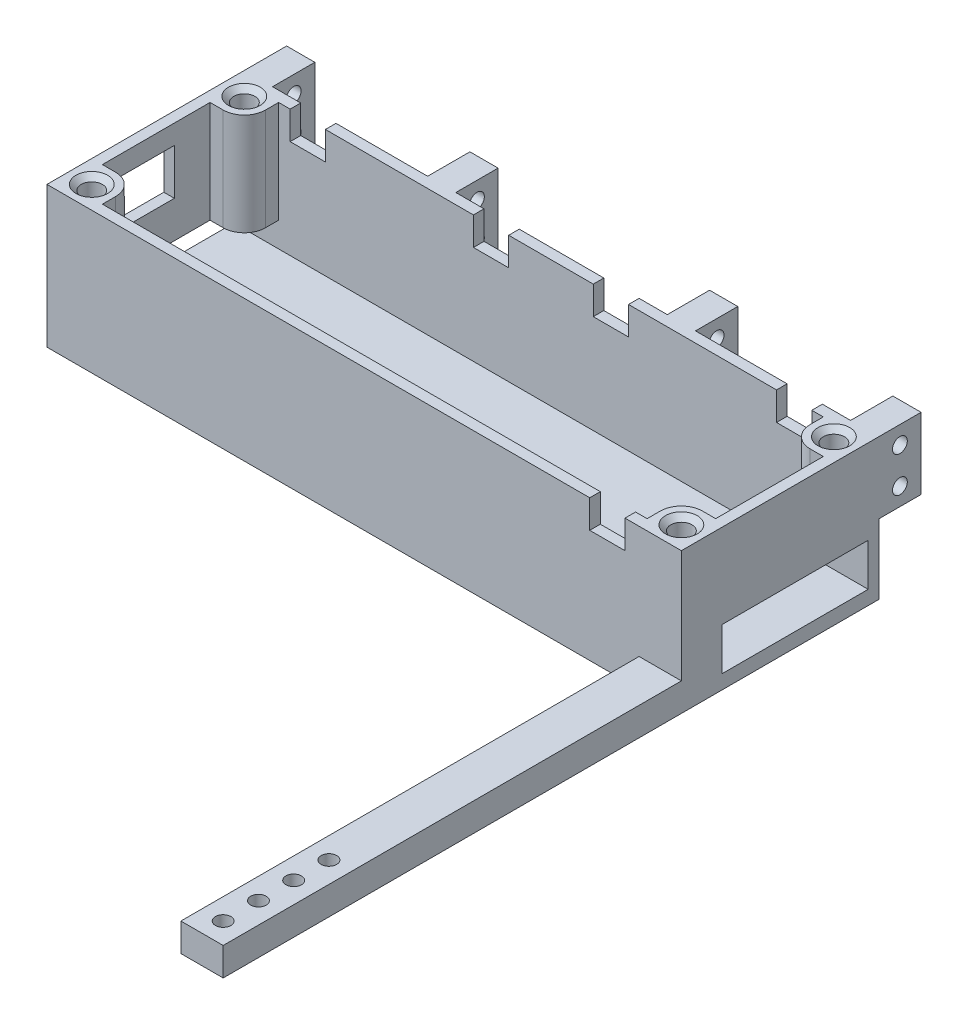
from build123d import *

# Parameters (mm, degrees)
SKETCH2_W           = 87
SKETCH2_H           = 25
BOSS_EXTRUDE1_DEPTH = 2
SKETCH2_3_W         = 90
SKETCH2_3_H         = 28
SKETCH2_3_W_2       = 87
SKETCH2_3_H_2       = 25
BOSS_EXTRUDE2_DEPTH = 20
SKETCH3_W           = 4
SKETCH3_H           = 10.1
BOSS_EXTRUDE3_DEPTH = 6
SKETCH5_R           = 1.05
CUT_EXTRUDE2_DEPTH  = 105
SKETCH3_5_W         = 5
SKETCH3_5_H         = 4
CUT_EXTRUDE3_DEPTH  = 16
SKETCH2_4_W         = 6
SKETCH2_4_H         = 55
BOSS_EXTRUDE4_DEPTH = 4
SKETCH8_W           = 4.863961031
SKETCH8_H           = 4.863961031
SKETCH8_W_2         = 4.86396103
BOSS_EXTRUDE5_DEPTH = 18
SKETCH9_R           = 1.5
CUT_EXTRUDE6_DEPTH  = 5
SKETCH6_W           = 11.14966652
SKETCH6_H           = 6.5
CUT_EXTRUDE4_DEPTH  = 16
FILLET1_R           = 3
SKETCH10_W          = 20.745878282
SKETCH10_H          = 3.532229036
CUT_EXTRUDE7_DEPTH  = 109.1
SKETCH11_W          = 5
SKETCH11_H          = 4
CUT_EXTRUDE8_DEPTH  = 4
SKETCH12_W          = 20.745878282
SKETCH12_H          = 2.501759487
CUT_EXTRUDE10_DEPTH = 8
SKETCH13_R          = 2.25
BOSS_EXTRUDE6_DEPTH = 3
CHAMFER1_SIZE       = 0.75
SKETCH17_W          = 6
SKETCH17_H          = 4
BOSS_EXTRUDE9_DEPTH = 10
SKETCH7_R           = 1.1
CUT_EXTRUDE5_DEPTH  = 10
CUT_EXTRUDE11_START = -1
SKETCH18_R          = 2.25
CUT_EXTRUDE11_DEPTH = 1


with BuildPart() as part:
    # Sketch2 → Boss-Extrude1 (new body)
    with BuildSketch(Plane(origin=(0, 0, 0), x_dir=(1, 0, 0), z_dir=(0, 1, 0))):
        with Locations((-2.329700272, 12.5)):
            Rectangle(SKETCH2_W, SKETCH2_H)
    extrude(amount=BOSS_EXTRUDE1_DEPTH)

    # Sketch2<3> → Boss-Extrude2 (add)
    with BuildSketch(Plane(origin=(0, 0, 0), x_dir=(1, 0, 0), z_dir=(0, 1, 0))):
        with Locations((-2.329700272, 12.5)):
            Rectangle(SKETCH2_3_W, SKETCH2_3_H)
        with Locations((-2.329700272, 12.5)):
            Rectangle(SKETCH2_3_W_2, SKETCH2_3_H_2, mode=Mode.SUBTRACT)
    extrude(amount=BOSS_EXTRUDE2_DEPTH)

    # Sketch3 → Boss-Extrude3 (add)
    with BuildSketch(Plane(origin=(0, 0, -26.5), x_dir=(-1, 0, 0), z_dir=(0, 0, -1))):
        with Locations((45.329700272, 14.95)):
            Rectangle(SKETCH3_W, SKETCH3_H)
        with Locations((-14.670299728, 14.95)):
            Rectangle(SKETCH3_W, SKETCH3_H)
        with Locations((-40.670299728, 14.95)):
            Rectangle(SKETCH3_W, SKETCH3_H)
        with Locations((19.329700272, 14.95)):
            Rectangle(SKETCH3_W, SKETCH3_H)
    extrude(amount=BOSS_EXTRUDE3_DEPTH)

    # Sketch5 → Cut-Extrude2 (cut)
    with BuildSketch(Plane.ZY.offset(47.329700272)):
        with Locations((-29.5, 12.425)):
            Circle(SKETCH5_R)
        with Locations((-29.5, 17.475)):
            Circle(SKETCH5_R)
    extrude(amount=-CUT_EXTRUDE2_DEPTH, mode=Mode.SUBTRACT)

    # Sketch3<5> → Cut-Extrude3 (cut)
    with BuildSketch(Plane(origin=(0, 0, -26.5), x_dir=(-1, 0, 0), z_dir=(0, 0, -1))):
        with Locations((36.829700272, 18)):
            Rectangle(SKETCH3_5_W, SKETCH3_5_H)
        with Locations((10.829700272, 18)):
            Rectangle(SKETCH3_5_W, SKETCH3_5_H)
        with Locations((-32.170299728, 18)):
            Rectangle(SKETCH3_5_W, SKETCH3_5_H)
        with Locations((-6.170299728, 18)):
            Rectangle(SKETCH3_5_W, SKETCH3_5_H)
    extrude(amount=-CUT_EXTRUDE3_DEPTH, mode=Mode.SUBTRACT)

    # Sketch2<4> → Boss-Extrude4 (add)
    with BuildSketch(Plane(origin=(0, 0, 0), x_dir=(1, 0, 0), z_dir=(0, 1, 0))):
        with Locations((39.670299728, -29)):
            Rectangle(SKETCH2_4_W, SKETCH2_4_H)
    extrude(amount=BOSS_EXTRUDE4_DEPTH)

    # Sketch8 → Boss-Extrude5 (add)
    with BuildSketch(Plane(origin=(0, 2, 0), x_dir=(1, 0, 0), z_dir=(0, 1, 0))):
        with Locations((38.738319213, 22.568019484)):
            Rectangle(SKETCH8_W, SKETCH8_H)
        with Locations((38.738319213, 2.431980516)):
            Rectangle(SKETCH8_W, SKETCH8_H)
        with Locations((-43.397719757, 22.568019484)):
            Rectangle(SKETCH8_W_2, SKETCH8_H)
        with Locations((-43.397719757, 2.431980516)):
            Rectangle(SKETCH8_W_2, SKETCH8_H)
    extrude(amount=BOSS_EXTRUDE5_DEPTH)

    # Sketch9 → Cut-Extrude6 (cut)
    with BuildSketch(Plane(origin=(0, 20, 0), x_dir=(1, 0, 0), z_dir=(0, 1, 0))):
        with Locations(Location((-44.147719757, 23.318019485, 0), (0, 0, 270))):
            Circle(SKETCH9_R)
        with Locations(Location((-44.147719757, 1.681980515, 0), (0, 0, 90))):
            Circle(SKETCH9_R)
        with Locations(Location((39.488319212, 1.681980515, 0), (0, 0, 270))):
            Circle(SKETCH9_R)
        with Locations(Location((39.488319212, 23.318019485, 0), (0, 0, 90))):
            Circle(SKETCH9_R)
    extrude(amount=-CUT_EXTRUDE6_DEPTH, mode=Mode.SUBTRACT)

    # Sketch6 → Cut-Extrude4 (cut)
    with BuildSketch(Plane.ZY.offset(47.329700272)):
        with Locations((-9.5, 14)):
            Rectangle(SKETCH6_W, SKETCH6_H)
    extrude(amount=-CUT_EXTRUDE4_DEPTH, mode=Mode.SUBTRACT)

    # Fillet1
    # the kernel refuses this fillet: 3 mm, written as the material it takes off along each edge
    with BuildSketch(Plane(origin=(36.306338697, 2, -4.863961031), x_dir=(0, 0, 1), z_dir=(0, 1, 0)), Plane(origin=(-40.965739242, 2, -20.136038969), x_dir=(0, 0, -1), z_dir=(0, 1, 0))) as fillet1_piece_1:
        with BuildLine():
            CenterArc((FILLET1_R, FILLET1_R), FILLET1_R, 180, 90)
            Line((0, FILLET1_R), (0, 0))
            Line((0, 0), (FILLET1_R, 0))
        make_face()
    extrude(amount=25.5, mode=Mode.SUBTRACT)
    with BuildSketch(Plane(origin=(36.306338697, 2, -20.136038969), x_dir=(0, 0, -1), z_dir=(0, 1, 0))) as fillet1_piece_2:
        with BuildLine():
            CenterArc((FILLET1_R, -FILLET1_R), FILLET1_R, 90, 90)
            Line((0, -FILLET1_R), (0, 0))
            Line((0, 0), (FILLET1_R, 0))
        make_face()
    extrude(amount=25.5, mode=Mode.SUBTRACT)
    with BuildSketch(Plane(origin=(-40.965739242, 2, -4.863961031), x_dir=(0, 0, 1), z_dir=(0, 1, 0))) as fillet1_piece_3:
        with BuildLine():
            CenterArc((FILLET1_R, -FILLET1_R), FILLET1_R, 90, 90)
            Line((0, -FILLET1_R), (0, 0))
            Line((0, 0), (FILLET1_R, 0))
        make_face()
    extrude(amount=16.25, mode=Mode.SUBTRACT)
    with BuildSketch(Plane(origin=(-40.965739242, 9.75, -4.863961031), x_dir=(-1, 0, 0), z_dir=(0, 1, 0))) as fillet1_piece_4:
        with BuildLine():
            CenterArc((FILLET1_R, FILLET1_R), FILLET1_R, 180, 90)
            Line((0, FILLET1_R), (0, 0))
            Line((0, 0), (FILLET1_R, 0))
        make_face()
    extrude(amount=17.75, mode=Mode.SUBTRACT)

    # Sketch10 → Cut-Extrude7 (cut)
    with BuildSketch(Plane.ZY.offset(47.329700272)):
        with Locations((-14.627060859, 3.766114518)):
            Rectangle(SKETCH10_W, SKETCH10_H)
    extrude(amount=-CUT_EXTRUDE7_DEPTH, mode=Mode.SUBTRACT)

    # Sketch11 → Cut-Extrude8 (cut)
    with BuildSketch(Plane.XY.offset(1.5)):
        with Locations((32.170299728, 18)):
            Rectangle(SKETCH11_W, SKETCH11_H)
    extrude(amount=-CUT_EXTRUDE8_DEPTH, mode=Mode.SUBTRACT)

    # Sketch12 → Cut-Extrude10 (cut)
    with BuildSketch(Plane(origin=(42.670299728, 0, 0), x_dir=(0, 0, -1), z_dir=(1, 0, 0))):
        with Locations((14.627060859, 6.78310878)):
            Rectangle(SKETCH12_W, SKETCH12_H)
    extrude(amount=-CUT_EXTRUDE10_DEPTH, mode=Mode.SUBTRACT)

    # Sketch13 → Boss-Extrude6 (add)
    # profile 1 of 2: a face of its own
    with BuildSketch(Plane(origin=(0, 2, 0), x_dir=(1, 0, 0), z_dir=(0, 1, 0))):
        with BuildLine():
            Line((-40.965739242, 1.863961031), (-40.965739242, 0))
            Line((-40.965739242, 0), (-34.465739242, 0))
            Line((-34.465739242, 0), (-34.465739242, 5.247890406))
            ThreePointArc((-34.465739242, 5.247890406), (-34.758632461, 5.954997187), (-35.465739242, 6.247890406))
            Line((-35.465739242, 6.247890406), (-40.619194745, 6.247890406))
            ThreePointArc((-40.619194745, 6.247890406), (-41.102765854, 6.123195485), (-41.465739242, 5.78020837))
            ThreePointArc((-41.465739242, 5.78020837), (-41.553823791, 5.60351457), (-41.605476886, 5.412958687))
            Line((-41.605476886, 5.412958687), (-41.844418898, 3.985281374))
            ThreePointArc((-41.844418898, 3.985281374), (-41.194100644, 3.012011328), (-40.965739242, 1.863961031))
        make_face()
        with Locations(Location((-37.965739242, 3.5, 0), (0, 0, 270))):
            Circle(SKETCH13_R, mode=Mode.SUBTRACT)
    # profile 2 of 2: a face of its own
    with BuildSketch(Plane(origin=(0, 2, 0), x_dir=(1, 0, 0), z_dir=(0, 1, 0))):
        with BuildLine():
            Line((-5.965739242, 0), (1.034260758, 0))
            Line((1.034260758, 0), (1.034260758, 5.247890406))
            ThreePointArc((1.034260758, 5.247890406), (0.741367539, 5.954997187), (0.034260758, 6.247890406))
            Line((0.034260758, 6.247890406), (-4.965739242, 6.247890406))
            ThreePointArc((-4.965739242, 6.247890406), (-5.672846023, 5.954997187), (-5.965739242, 5.247890406))
            Line((-5.965739242, 5.247890406), (-5.965739242, 0))
        make_face()
        with Locations(Location((-2.465739242, 3.5, 0), (0, 0, 270))):
            Circle(SKETCH13_R, mode=Mode.SUBTRACT)
    extrude(amount=BOSS_EXTRUDE6_DEPTH)

    # Chamfer1
    chamfer1_edges = [part.edges().sort_by_distance(p)[0] for p in [
        (39.488319212, 20, -21.818019485),
        (39.488319212, 20, -3.181980515),
        (-44.147719757, 20, -0.181980515),
        (-44.147719757, 20, -24.818019485),
    ]]
    chamfer(chamfer1_edges, length=CHAMFER1_SIZE)

    # Sketch17 → Boss-Extrude9 (add)
    with BuildSketch(Plane.XY.offset(56.5)):
        with Locations((39.670299728, 2)):
            Rectangle(SKETCH17_W, SKETCH17_H)
    extrude(amount=BOSS_EXTRUDE9_DEPTH)

    # Sketch7 → Cut-Extrude5 (cut)
    with BuildSketch(Plane(origin=(0, 4, 0), x_dir=(1, 0, 0), z_dir=(0, 1, 0))):
        with Locations(Location((39.670299728, -63.5, 0), (0, 0, 270))):
            Circle(SKETCH7_R)
        with Locations(Location((39.670299728, -58.5, 0), (0, 0, 270))):
            Circle(SKETCH7_R)
        with Locations(Location((39.670299728, -48.5, 0), (0, 0, 270))):
            Circle(SKETCH7_R)
        with Locations(Location((39.670299728, -53.5, 0), (0, 0, 270))):
            Circle(SKETCH7_R)
    extrude(amount=-CUT_EXTRUDE5_DEPTH, mode=Mode.SUBTRACT)

    # Sketch18 → Cut-Extrude11 (cut)
    with BuildSketch(Plane(origin=(0, 2, 0), x_dir=(1, 0, 0), z_dir=(0, 1, 0)).offset(CUT_EXTRUDE11_START)):
        with Locations(Location((-37.965739242, 3.5, 0), (0, 0, 270))):
            Circle(SKETCH18_R)
        with Locations(Location((-2.465739242, 3.5, 0), (0, 0, 270))):
            Circle(SKETCH18_R)
    extrude(amount=CUT_EXTRUDE11_DEPTH, mode=Mode.SUBTRACT)


solid = part.part
